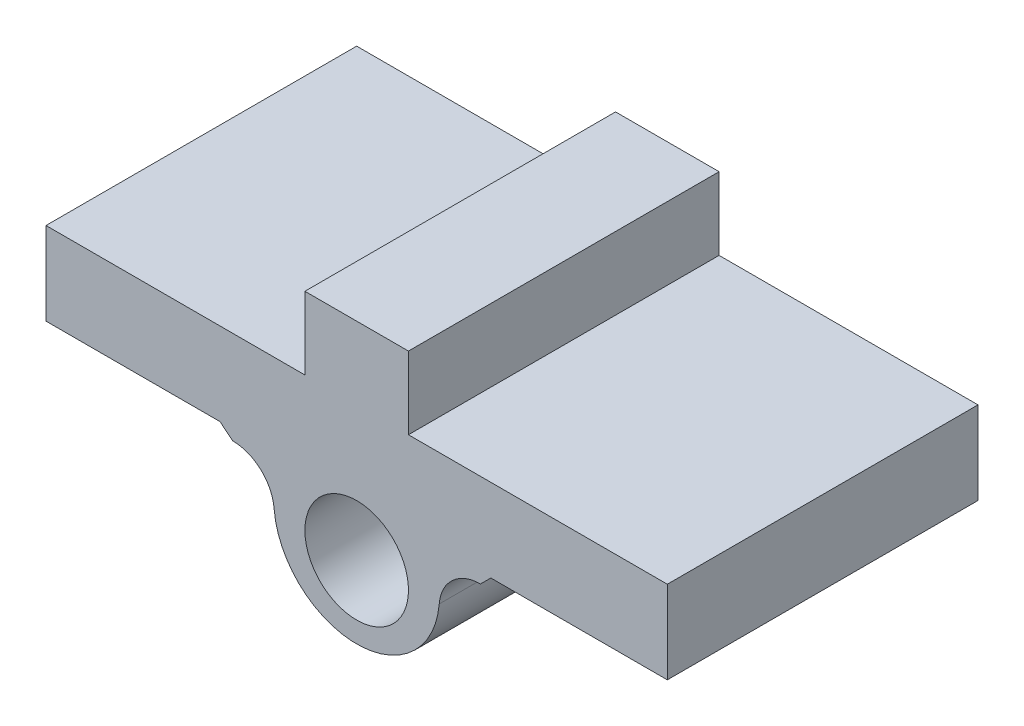
from build123d import *

# Parameters (mm, degrees)
SKETCH1_W           = 60
SKETCH1_H           = 30
BOSS_EXTRUDE1_DEPTH = 8
SKETCH3_W           = 10
SKETCH3_H           = 30
BOSS_EXTRUDE5_DEPTH = 7
SKETCH5_W           = 14
SKETCH5_H           = 30
BOSS_EXTRUDE6_DEPTH = 11
SKETCH6_R           = 5
CUT_EXTRUDE1_DEPTH  = 69.738635424
FILLET1_R           = 7
FILLET2_R           = 5
FILLET3_R           = 5
BOSS_EXTRUDE7_DEPTH = 30


with BuildPart() as part:
    # Sketch1 → Boss-Extrude1 (new body)
    with BuildSketch(Plane(origin=(0, 0, 0), x_dir=(1, 0, 0), z_dir=(0, 1, 0))):
        with Locations((30, 15)):
            Rectangle(SKETCH1_W, SKETCH1_H)
    extrude(amount=BOSS_EXTRUDE1_DEPTH)

    # Sketch3 → Boss-Extrude5 (add)
    with BuildSketch(Plane(origin=(0, 8, 0), x_dir=(1, 0, 0), z_dir=(0, 1, 0))):
        with Locations((30, 15)):
            Rectangle(SKETCH3_W, SKETCH3_H)
    extrude(amount=BOSS_EXTRUDE5_DEPTH)

    # Sketch5 → Boss-Extrude6 (add)
    with BuildSketch(Plane.XZ):
        with Locations((30, -15)):
            Rectangle(SKETCH5_W, SKETCH5_H)
    extrude(amount=BOSS_EXTRUDE6_DEPTH)

    # Sketch6 → Cut-Extrude1 (cut, through all)
    with BuildSketch(Plane(origin=(0, 0, -30), x_dir=(-1, 0, 0), z_dir=(0, 0, -1))):
        with Locations((-30, -5)):
            Circle(SKETCH6_R)
    extrude(amount=-CUT_EXTRUDE1_DEPTH, mode=Mode.SUBTRACT)

    # Fillet1
    fillet1_edges = [part.edges().sort_by_distance(p)[0] for p in [
        (23, -11, -15),
        (37, -11, -15),
    ]]
    fillet(fillet1_edges, radius=FILLET1_R - 0.0001)  # a hair under: the kernel refuses the full size

    # Fillet2
    fillet2_edges = [part.edges().sort_by_distance(p)[0] for p in [
        (23, 0, -15),
    ]]
    fillet(fillet2_edges, radius=FILLET2_R)

    # Fillet3
    fillet3_edges = [part.edges().sort_by_distance(p)[0] for p in [
        (37, 0, -15),
    ]]
    fillet(fillet3_edges, radius=FILLET3_R)

    # Sketch8 → Boss-Extrude7 (add)
    with BuildSketch(Plane(origin=(0, 0, -30), x_dir=(-1, 0, 0), z_dir=(0, 0, -1))):
        with BuildLine():
            Line((-41.958260743, -1), (-42.958260743, 0))
            Line((-42.958260743, 0), (-41.958260743, 0))
            ThreePointArc((-41.958260743, 0), (-38.573244741, -1.320099639), (-36.9756521, -4.583333333))
            ThreePointArc((-36.9756521, -4.583333333), (-34.739022403, -9.151860505), (-30, -11))
            ThreePointArc((-30, -11), (-25.260977597, -9.151860505), (-23.0243479, -4.583333333))
            ThreePointArc((-23.0243479, -4.583333333), (-21.426755259, -1.320099639), (-18.041739257, 0))
            Line((-18.041739257, 0), (-16.803044796, 0))
            Line((-16.803044796, 0), (-18.041739257, -1))
            ThreePointArc((-18.041739257, -1), (-20.749752058, -2.056079711), (-22.027826171, -4.666666667))
            ThreePointArc((-22.027826171, -4.666666667), (-24.583974397, -9.887840578), (-30, -12))
            ThreePointArc((-30, -12), (-35.416025603, -9.887840578), (-37.972173829, -4.666666667))
            ThreePointArc((-37.972173829, -4.666666667), (-39.250247942, -2.056079711), (-41.958260743, -1))
        make_face()
    extrude(amount=-BOSS_EXTRUDE7_DEPTH)


solid = part.part
